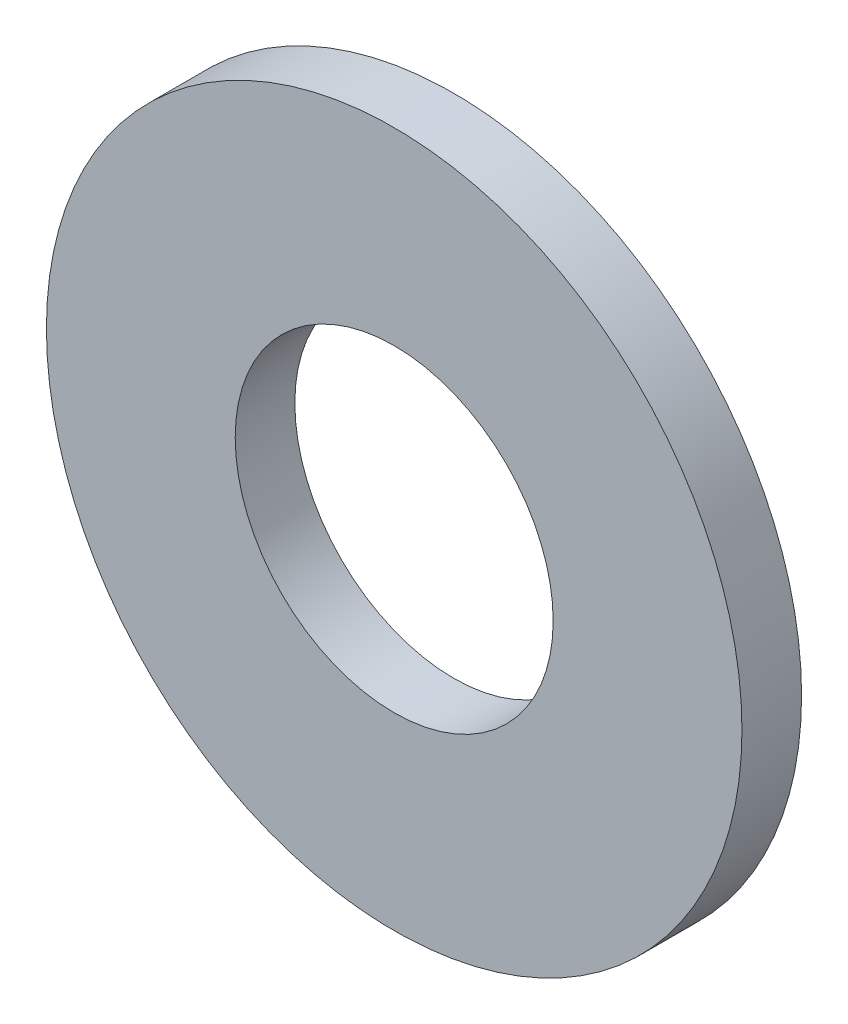
from build123d import *

# Parameters (mm, degrees)
SKETCH1_R           = 3.5
SKETCH1_R_2         = 1.6
BOSS_EXTRUDE1_DEPTH = 0.6


with BuildPart() as part:
    # Sketch1 → Boss-Extrude1 (new body)
    with BuildSketch(Plane.XY):
        Circle(SKETCH1_R)
        Circle(SKETCH1_R_2, mode=Mode.SUBTRACT)
    extrude(amount=BOSS_EXTRUDE1_DEPTH)


solid = part.part
